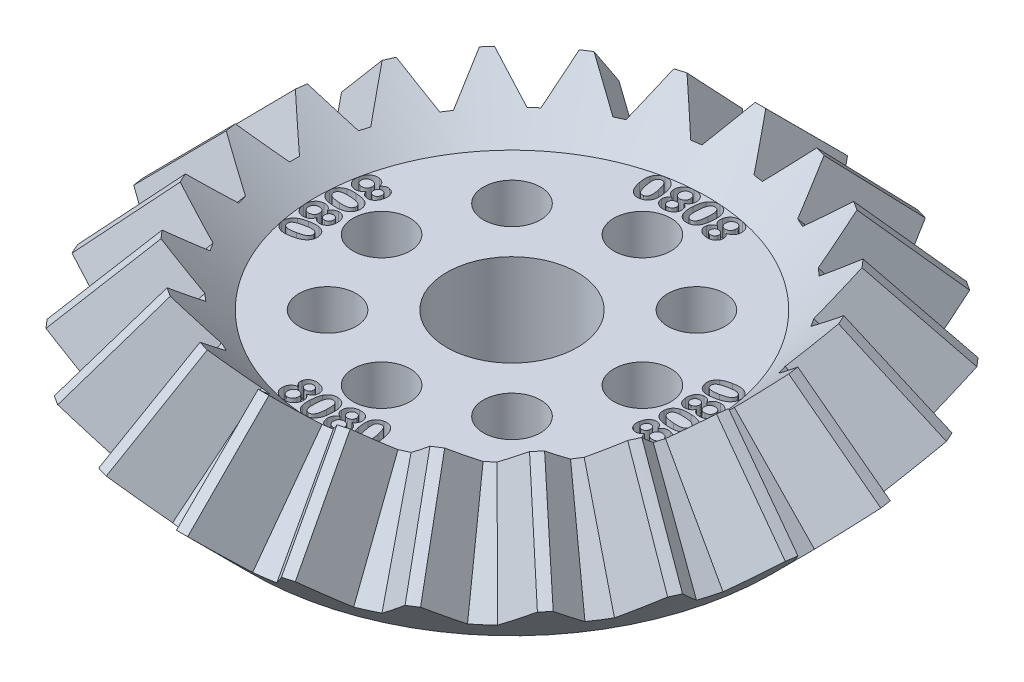
from build123d import *

# Parameters (mm, degrees)
CUT_EXTRUDE3_DEPTH        = 10
SKETCH5_3_R               = 1.75
CUT_EXTRUDE4_DEPTH        = 10
CIRPATTERN3_COUNT         = 8
CUT_EXTRUDE9_DEPTH        = 10
CUT_EXTRUDE9_DRAFT        = -5
CIRPATTERN9_COPY_1_DEPTH  = 10
CIRPATTERN9_COPY_1_DRAFT  = -5
CIRPATTERN9_COPY_2_DEPTH  = 10
CIRPATTERN9_COPY_2_DRAFT  = -5
CIRPATTERN9_COPY_3_DEPTH  = 10
CIRPATTERN9_COPY_3_DRAFT  = -5
CIRPATTERN9_COPY_4_DEPTH  = 10
CIRPATTERN9_COPY_4_DRAFT  = -5
CIRPATTERN9_COPY_5_DEPTH  = 10
CIRPATTERN9_COPY_5_DRAFT  = -5
CIRPATTERN9_COPY_6_DEPTH  = 10
CIRPATTERN9_COPY_6_DRAFT  = -5
CIRPATTERN9_COPY_7_DEPTH  = 10
CIRPATTERN9_COPY_7_DRAFT  = -5
CIRPATTERN9_COPY_8_DEPTH  = 10
CIRPATTERN9_COPY_8_DRAFT  = -5
CIRPATTERN9_COPY_9_DEPTH  = 10
CIRPATTERN9_COPY_9_DRAFT  = -5
CIRPATTERN9_COPY_10_DEPTH = 10
CIRPATTERN9_COPY_10_DRAFT = -5
CIRPATTERN9_COPY_11_DEPTH = 10
CIRPATTERN9_COPY_11_DRAFT = -5
CIRPATTERN9_COPY_12_DEPTH = 10
CIRPATTERN9_COPY_12_DRAFT = -5
CIRPATTERN9_COPY_13_DEPTH = 10
CIRPATTERN9_COPY_13_DRAFT = -5
CIRPATTERN9_COPY_14_DEPTH = 10
CIRPATTERN9_COPY_14_DRAFT = -5
CIRPATTERN9_COPY_15_DEPTH = 10
CIRPATTERN9_COPY_15_DRAFT = -5
CIRPATTERN9_COPY_16_DEPTH = 10
CIRPATTERN9_COPY_16_DRAFT = -5
CIRPATTERN9_COPY_17_DEPTH = 10
CIRPATTERN9_COPY_17_DRAFT = -5
CIRPATTERN9_COPY_18_DEPTH = 10
CIRPATTERN9_COPY_18_DRAFT = -5
CIRPATTERN9_COPY_19_DEPTH = 10
CIRPATTERN9_COPY_19_DRAFT = -5
CIRPATTERN9_COPY_20_DEPTH = 10
CIRPATTERN9_COPY_20_DRAFT = -5
CIRPATTERN9_COPY_21_DEPTH = 10
CIRPATTERN9_COPY_21_DRAFT = -5
CUT_EXTRUDE10_DEPTH       = 1
CIRPATTERN10_COUNT        = 4


with BuildPart() as part:
    # Sketch2 → Revolve4 (revolve)
    with BuildSketch(Plane.XY):
        Polygon((0, 0), (0, 6), (-12, 6), (-15.242640687, 9.242640687), (-20.242640687, 4.242640687), (-16, 0), align=None)
    revolve(axis=Axis((0, 0, 0), (0, 1, 0)))

    # Sketch5 → Cut-Extrude3 (cut)
    with BuildSketch(Plane(origin=(0, 6, 0), x_dir=(1, 0, 0), z_dir=(0, 1, 0))):
        with BuildLine():
            ThreePointArc((4, 0), (-2.828427125, 2.828427125), (0, -4))
            ThreePointArc((0, -4), (2.828427125, -2.828427125), (4, 0))
        make_face()
    extrude(amount=-CUT_EXTRUDE3_DEPTH, mode=Mode.SUBTRACT)

    # Sketch5<3> → Cut-Extrude4 (cut)
    with BuildSketch(Plane(origin=(0, 6, 0), x_dir=(1, 0, 0), z_dir=(0, 1, 0))):
        with Locations((0, -8)):
            Circle(SKETCH5_3_R)
    cut_extrude4 = extrude(amount=-CUT_EXTRUDE4_DEPTH, mode=Mode.SUBTRACT)

    # CirPattern3: Cut-Extrude4 ×8 about axis
    cirpattern3_axis = Axis((0, 0, 0), (0, 1, 0))
    for i in range(1, CIRPATTERN3_COUNT):
        add(cut_extrude4.rotate(cirpattern3_axis, i * 360 / CIRPATTERN3_COUNT), mode=Mode.SUBTRACT)


with BuildPart() as cut_extrude9_tool:
    # Sketch4 → Cut-Extrude9 (with draft: the straight prism first)
    with BuildSketch(Plane(origin=(-8, -8, 0), x_dir=(0, 0, 1), z_dir=(-0.7071067811865476, -0.7071067811865475, 0))):
        Polygon((0.655287698, 14.004205364), (3, 17.955775999), (-3, 17.955775999), (-0.655287698, 14.004205364), align=None)
    extrude(amount=-CUT_EXTRUDE9_DEPTH)
    # Cut-Extrude9: the draft: its side faces are tilted about the plane it starts from
    cut_extrude9_sides = [cut_extrude9_tool.faces().sort_by_distance(p)[0] for p in [
        (-15.764025868, 6.83509368, 1.827643849),
        (-17.161117065, 8.232184876, 0),
        (-15.764025868, 6.83509368, -1.827643849),
        (-14.366934672, 5.438002484, 0),
    ]]
    draft(cut_extrude9_sides, Plane(origin=(-8, -8, 0), x_dir=(0, 0, 1), z_dir=(-0.7071067811865476, -0.7071067811865475, 0)), CUT_EXTRUDE9_DRAFT)


with BuildPart() as part_1:
    add(part.part)

    # Cut-Extrude9: cut by cut_extrude9_tool
    add(cut_extrude9_tool.part, mode=Mode.SUBTRACT)


with BuildPart() as cirpattern9_copy_1_tool:
    # CirPattern9 copy 1 sketch → CirPattern9 copy 1 (with draft: the straight prism first)
    with BuildSketch(Plane(origin=(-7.675943789, -8, 2.253860455), x_dir=(0.28173255684142967, 0, 0.9594929736144974), z_dir=(-0.6784639881436563, -0.7071067811865475, 0.19921500142359938))):
        Polygon((0.655287698, 14.004205364), (3, 17.955775999), (-3, 17.955775999), (-0.655287698, 14.004205364), align=None)
    extrude(amount=-CIRPATTERN9_COPY_1_DEPTH)
    # CirPattern9 copy 1: the draft: its side faces are tilted about the plane it starts from
    cirpattern9_copy_1_sides = [cirpattern9_copy_1_tool.faces().sort_by_distance(p)[0] for p in [
        (-14.610565282, 6.83509368, 6.194850745),
        (-16.465971243, 8.232184876, 4.834845389),
        (-15.640378831, 6.83509368, 2.687627883),
        (-13.78497287, 5.438002484, 4.047633239),
    ]]
    draft(cirpattern9_copy_1_sides, Plane(origin=(-7.675943789, -8, 2.253860455), x_dir=(0.28173255684142967, 0, 0.9594929736144974), z_dir=(-0.6784639881436563, -0.7071067811865475, 0.19921500142359938)), CIRPATTERN9_COPY_1_DRAFT)


with BuildPart() as part_2:
    add(part_1.part)

    # CirPattern9 copy 1: cut by cirpattern9_copy_1_tool
    add(cirpattern9_copy_1_tool.part, mode=Mode.SUBTRACT)


with BuildPart() as cirpattern9_copy_2_tool:
    # CirPattern9 copy 2 sketch → CirPattern9 copy 2 (with draft: the straight prism first)
    with BuildSketch(Plane(origin=(-6.730028263, -8, 4.32512654), x_dir=(0.5406408174555976, 0, 0.8412535328311812), z_dir=(-0.5948560777620682, -0.7071067811865475, 0.3822907882090914))):
        Polygon((0.655287698, 14.004205364), (3, 17.955775999), (-3, 17.955775999), (-0.655287698, 14.004205364), align=None)
    extrude(amount=-CIRPATTERN9_COPY_2_DEPTH)
    # CirPattern9 copy 2: the draft: its side faces are tilted about the plane it starts from
    cirpattern9_copy_2_sides = [cirpattern9_copy_2_tool.faces().sort_by_distance(p)[0] for p in [
        (-12.273443589, 6.83509368, 10.060187676),
        (-14.436850358, 8.232184876, 9.278000358),
        (-14.249641318, 6.83509368, 6.985163987),
        (-12.086234549, 5.438002484, 7.767351305),
    ]]
    draft(cirpattern9_copy_2_sides, Plane(origin=(-6.730028263, -8, 4.32512654), x_dir=(0.5406408174555976, 0, 0.8412535328311812), z_dir=(-0.5948560777620682, -0.7071067811865475, 0.3822907882090914)), CIRPATTERN9_COPY_2_DRAFT)


with BuildPart() as part_3:
    add(part_2.part)

    # CirPattern9 copy 2: cut by cirpattern9_copy_2_tool
    add(cirpattern9_copy_2_tool.part, mode=Mode.SUBTRACT)


with BuildPart() as cirpattern9_copy_3_tool:
    # CirPattern9 copy 3 sketch → CirPattern9 copy 3 (with draft: the straight prism first)
    with BuildSketch(Plane(origin=(-5.238885872, -8, 6.045996595), x_dir=(0.7557495743542583, 0, 0.654860733945285), z_dir=(-0.46305646570551057, -0.7071067811865475, 0.534395648904743))):
        Polygon((0.655287698, 14.004205364), (3, 17.955775999), (-3, 17.955775999), (-0.655287698, 14.004205364), align=None)
    extrude(amount=-CIRPATTERN9_COPY_3_DEPTH)
    # CirPattern9 copy 3: the draft: its side faces are tilted about the plane it starts from
    cirpattern9_copy_3_sides = [cirpattern9_copy_3_tool.faces().sort_by_distance(p)[0] for p in [
        (-8.942000489, 6.83509368, 13.110508032),
        (-11.238141717, 8.232184876, 12.969506917),
        (-11.704482611, 6.83509368, 10.716803648),
        (-9.408341384, 5.438002484, 10.857804763),
    ]]
    draft(cirpattern9_copy_3_sides, Plane(origin=(-5.238885872, -8, 6.045996595), x_dir=(0.7557495743542583, 0, 0.654860733945285), z_dir=(-0.46305646570551057, -0.7071067811865475, 0.534395648904743)), CIRPATTERN9_COPY_3_DRAFT)


with BuildPart() as part_4:
    add(part_3.part)

    # CirPattern9 copy 3: cut by cirpattern9_copy_3_tool
    add(cirpattern9_copy_3_tool.part, mode=Mode.SUBTRACT)


with BuildPart() as cirpattern9_copy_4_tool:
    # CirPattern9 copy 4 sketch → CirPattern9 copy 4 (with draft: the straight prism first)
    with BuildSketch(Plane(origin=(-3.323320104, -8, 7.277055963), x_dir=(0.9096319953545183, 0, 0.41541501300188644), z_dir=(-0.2937427727003317, -0.7071067811865475, 0.64320695229943))):
        Polygon((0.655287698, 14.004205364), (3, 17.955775999), (-3, 17.955775999), (-0.655287698, 14.004205364), align=None)
    extrude(amount=-CIRPATTERN9_COPY_4_DEPTH)
    # CirPattern9 copy 4: the draft: its side faces are tilted about the plane it starts from
    cirpattern9_copy_4_sides = [cirpattern9_copy_4_tool.faces().sort_by_distance(p)[0] for p in [
        (-4.88612969, 6.83509368, 15.098692998),
        (-7.128985669, 8.232184876, 15.610301158),
        (-8.211096332, 6.83509368, 13.580231612),
        (-5.968240354, 5.438002484, 13.068623453),
    ]]
    draft(cirpattern9_copy_4_sides, Plane(origin=(-3.323320104, -8, 7.277055963), x_dir=(0.9096319953545183, 0, 0.41541501300188644), z_dir=(-0.2937427727003317, -0.7071067811865475, 0.64320695229943)), CIRPATTERN9_COPY_4_DRAFT)


with BuildPart() as part_5:
    add(part_4.part)

    # CirPattern9 copy 4: cut by cirpattern9_copy_4_tool
    add(cirpattern9_copy_4_tool.part, mode=Mode.SUBTRACT)


with BuildPart() as cirpattern9_copy_5_tool:
    # CirPattern9 copy 5 sketch → CirPattern9 copy 5 (with draft: the straight prism first)
    with BuildSketch(Plane(origin=(-1.138518706, -8, 7.918571535), x_dir=(0.9898214418809327, 0, 0.14231483827328534), z_dir=(-0.10063178720650688, -0.7071067811865475, 0.6999094537178537))):
        Polygon((0.655287698, 14.004205364), (3, 17.955775999), (-3, 17.955775999), (-0.655287698, 14.004205364), align=None)
    extrude(amount=-CIRPATTERN9_COPY_5_DEPTH)
    # CirPattern9 copy 5: the draft: its side faces are tilted about the plane it starts from
    cirpattern9_copy_5_sides = [cirpattern9_copy_5_tool.faces().sort_by_distance(p)[0] for p in [
        (-0.434413722, 6.83509368, 15.863671653),
        (-2.4422816, 8.232184876, 16.986441638),
        (-4.052495862, 6.83509368, 15.343469976),
        (-2.044627984, 5.438002484, 14.220699992),
    ]]
    draft(cirpattern9_copy_5_sides, Plane(origin=(-1.138518706, -8, 7.918571535), x_dir=(0.9898214418809327, 0, 0.14231483827328534), z_dir=(-0.10063178720650688, -0.7071067811865475, 0.6999094537178537)), CIRPATTERN9_COPY_5_DRAFT)


with BuildPart() as part_6:
    add(part_5.part)

    # CirPattern9 copy 5: cut by cirpattern9_copy_5_tool
    add(cirpattern9_copy_5_tool.part, mode=Mode.SUBTRACT)


with BuildPart() as cirpattern9_copy_6_tool:
    # CirPattern9 copy 6 sketch → CirPattern9 copy 6 (with draft: the straight prism first)
    with BuildSketch(Plane(origin=(1.138518706, -8, 7.918571535), x_dir=(0.9898214418809327, 0, -0.14231483827328523), z_dir=(0.1006317872065068, -0.7071067811865475, 0.6999094537178537))):
        Polygon((0.655287698, 14.004205364), (3, 17.955775999), (-3, 17.955775999), (-0.655287698, 14.004205364), align=None)
    extrude(amount=-CIRPATTERN9_COPY_6_DEPTH)
    # CirPattern9 copy 6: the draft: its side faces are tilted about the plane it starts from
    cirpattern9_copy_6_sides = [cirpattern9_copy_6_tool.faces().sort_by_distance(p)[0] for p in [
        (4.052495862, 6.83509368, 15.343469976),
        (2.4422816, 8.232184876, 16.986441638),
        (0.434413722, 6.83509368, 15.863671653),
        (2.044627984, 5.438002484, 14.220699992),
    ]]
    draft(cirpattern9_copy_6_sides, Plane(origin=(1.138518706, -8, 7.918571535), x_dir=(0.9898214418809327, 0, -0.14231483827328523), z_dir=(0.1006317872065068, -0.7071067811865475, 0.6999094537178537)), CIRPATTERN9_COPY_6_DRAFT)


with BuildPart() as part_7:
    add(part_6.part)

    # CirPattern9 copy 6: cut by cirpattern9_copy_6_tool
    add(cirpattern9_copy_6_tool.part, mode=Mode.SUBTRACT)


with BuildPart() as cirpattern9_copy_7_tool:
    # CirPattern9 copy 7 sketch → CirPattern9 copy 7 (with draft: the straight prism first)
    with BuildSketch(Plane(origin=(3.323320104, -8, 7.277055963), x_dir=(0.9096319953545184, 0, -0.4154150130018863), z_dir=(0.29374277270033167, -0.7071067811865475, 0.6432069522994301))):
        Polygon((0.655287698, 14.004205364), (3, 17.955775999), (-3, 17.955775999), (-0.655287698, 14.004205364), align=None)
    extrude(amount=-CIRPATTERN9_COPY_7_DEPTH)
    # CirPattern9 copy 7: the draft: its side faces are tilted about the plane it starts from
    cirpattern9_copy_7_sides = [cirpattern9_copy_7_tool.faces().sort_by_distance(p)[0] for p in [
        (8.211096332, 6.83509368, 13.580231612),
        (7.128985669, 8.232184876, 15.610301158),
        (4.88612969, 6.83509368, 15.098692998),
        (5.968240354, 5.438002484, 13.068623453),
    ]]
    draft(cirpattern9_copy_7_sides, Plane(origin=(3.323320104, -8, 7.277055963), x_dir=(0.9096319953545184, 0, -0.4154150130018863), z_dir=(0.29374277270033167, -0.7071067811865475, 0.6432069522994301)), CIRPATTERN9_COPY_7_DRAFT)


with BuildPart() as part_8:
    add(part_7.part)

    # CirPattern9 copy 7: cut by cirpattern9_copy_7_tool
    add(cirpattern9_copy_7_tool.part, mode=Mode.SUBTRACT)


with BuildPart() as cirpattern9_copy_8_tool:
    # CirPattern9 copy 8 sketch → CirPattern9 copy 8 (with draft: the straight prism first)
    with BuildSketch(Plane(origin=(5.238885872, -8, 6.045996595), x_dir=(0.7557495743542583, 0, -0.654860733945285), z_dir=(0.46305646570551057, -0.7071067811865475, 0.534395648904743))):
        Polygon((0.655287698, 14.004205364), (3, 17.955775999), (-3, 17.955775999), (-0.655287698, 14.004205364), align=None)
    extrude(amount=-CIRPATTERN9_COPY_8_DEPTH)
    # CirPattern9 copy 8: the draft: its side faces are tilted about the plane it starts from
    cirpattern9_copy_8_sides = [cirpattern9_copy_8_tool.faces().sort_by_distance(p)[0] for p in [
        (11.704482611, 6.83509368, 10.716803648),
        (11.238141717, 8.232184876, 12.969506917),
        (8.942000489, 6.83509368, 13.110508032),
        (9.408341384, 5.438002484, 10.857804763),
    ]]
    draft(cirpattern9_copy_8_sides, Plane(origin=(5.238885872, -8, 6.045996595), x_dir=(0.7557495743542583, 0, -0.654860733945285), z_dir=(0.46305646570551057, -0.7071067811865475, 0.534395648904743)), CIRPATTERN9_COPY_8_DRAFT)


with BuildPart() as part_9:
    add(part_8.part)

    # CirPattern9 copy 8: cut by cirpattern9_copy_8_tool
    add(cirpattern9_copy_8_tool.part, mode=Mode.SUBTRACT)


with BuildPart() as cirpattern9_copy_9_tool:
    # CirPattern9 copy 9 sketch → CirPattern9 copy 9 (with draft: the straight prism first)
    with BuildSketch(Plane(origin=(6.730028263, -8, 4.32512654), x_dir=(0.5406408174555974, 0, -0.8412535328311813), z_dir=(0.5948560777620683, -0.7071067811865475, 0.38229078820909135))):
        Polygon((0.655287698, 14.004205364), (3, 17.955775999), (-3, 17.955775999), (-0.655287698, 14.004205364), align=None)
    extrude(amount=-CIRPATTERN9_COPY_9_DEPTH)
    # CirPattern9 copy 9: the draft: its side faces are tilted about the plane it starts from
    cirpattern9_copy_9_sides = [cirpattern9_copy_9_tool.faces().sort_by_distance(p)[0] for p in [
        (14.249641318, 6.83509368, 6.985163987),
        (14.436850358, 8.232184876, 9.278000358),
        (12.273443589, 6.83509368, 10.060187676),
        (12.086234549, 5.438002484, 7.767351305),
    ]]
    draft(cirpattern9_copy_9_sides, Plane(origin=(6.730028263, -8, 4.32512654), x_dir=(0.5406408174555974, 0, -0.8412535328311813), z_dir=(0.5948560777620683, -0.7071067811865475, 0.38229078820909135)), CIRPATTERN9_COPY_9_DRAFT)


with BuildPart() as part_10:
    add(part_9.part)

    # CirPattern9 copy 9: cut by cirpattern9_copy_9_tool
    add(cirpattern9_copy_9_tool.part, mode=Mode.SUBTRACT)


with BuildPart() as cirpattern9_copy_10_tool:
    # CirPattern9 copy 10 sketch → CirPattern9 copy 10 (with draft: the straight prism first)
    with BuildSketch(Plane(origin=(7.675943789, -8, 2.253860455), x_dir=(0.28173255684143006, 0, -0.9594929736144973), z_dir=(0.6784639881436562, -0.7071067811865475, 0.19921500142359966))):
        Polygon((0.655287698, 14.004205364), (3, 17.955775999), (-3, 17.955775999), (-0.655287698, 14.004205364), align=None)
    extrude(amount=-CIRPATTERN9_COPY_10_DEPTH)
    # CirPattern9 copy 10: the draft: its side faces are tilted about the plane it starts from
    cirpattern9_copy_10_sides = [cirpattern9_copy_10_tool.faces().sort_by_distance(p)[0] for p in [
        (15.640378831, 6.83509368, 2.687627883),
        (16.465971243, 8.232184876, 4.834845389),
        (14.610565282, 6.83509368, 6.194850745),
        (13.78497287, 5.438002484, 4.047633239),
    ]]
    draft(cirpattern9_copy_10_sides, Plane(origin=(7.675943789, -8, 2.253860455), x_dir=(0.28173255684143006, 0, -0.9594929736144973), z_dir=(0.6784639881436562, -0.7071067811865475, 0.19921500142359966)), CIRPATTERN9_COPY_10_DRAFT)


with BuildPart() as part_11:
    add(part_10.part)

    # CirPattern9 copy 10: cut by cirpattern9_copy_10_tool
    add(cirpattern9_copy_10_tool.part, mode=Mode.SUBTRACT)


with BuildPart() as cirpattern9_copy_11_tool:
    # CirPattern9 copy 11 sketch → CirPattern9 copy 11 (with draft: the straight prism first)
    with BuildSketch(Plane(origin=(8, -8, 0), x_dir=(0, 0, -1), z_dir=(0.7071067811865476, -0.7071067811865475, 0))):
        Polygon((0.655287698, 14.004205364), (3, 17.955775999), (-3, 17.955775999), (-0.655287698, 14.004205364), align=None)
    extrude(amount=-CIRPATTERN9_COPY_11_DEPTH)
    # CirPattern9 copy 11: the draft: its side faces are tilted about the plane it starts from
    cirpattern9_copy_11_sides = [cirpattern9_copy_11_tool.faces().sort_by_distance(p)[0] for p in [
        (15.764025868, 6.83509368, -1.827643849),
        (17.161117065, 8.232184876, 0),
        (15.764025868, 6.83509368, 1.827643849),
        (14.366934672, 5.438002484, 0),
    ]]
    draft(cirpattern9_copy_11_sides, Plane(origin=(8, -8, 0), x_dir=(0, 0, -1), z_dir=(0.7071067811865476, -0.7071067811865475, 0)), CIRPATTERN9_COPY_11_DRAFT)


with BuildPart() as part_12:
    add(part_11.part)

    # CirPattern9 copy 11: cut by cirpattern9_copy_11_tool
    add(cirpattern9_copy_11_tool.part, mode=Mode.SUBTRACT)


with BuildPart() as cirpattern9_copy_12_tool:
    # CirPattern9 copy 12 sketch → CirPattern9 copy 12 (with draft: the straight prism first)
    with BuildSketch(Plane(origin=(7.675943789, -8, -2.253860455), x_dir=(-0.28173255684142984, 0, -0.9594929736144974), z_dir=(0.6784639881436563, -0.7071067811865475, -0.1992150014235995))):
        Polygon((0.655287698, 14.004205364), (3, 17.955775999), (-3, 17.955775999), (-0.655287698, 14.004205364), align=None)
    extrude(amount=-CIRPATTERN9_COPY_12_DEPTH)
    # CirPattern9 copy 12: the draft: its side faces are tilted about the plane it starts from
    cirpattern9_copy_12_sides = [cirpattern9_copy_12_tool.faces().sort_by_distance(p)[0] for p in [
        (14.610565282, 6.83509368, -6.194850745),
        (16.465971243, 8.232184876, -4.834845389),
        (15.640378831, 6.83509368, -2.687627883),
        (13.78497287, 5.438002484, -4.047633239),
    ]]
    draft(cirpattern9_copy_12_sides, Plane(origin=(7.675943789, -8, -2.253860455), x_dir=(-0.28173255684142984, 0, -0.9594929736144974), z_dir=(0.6784639881436563, -0.7071067811865475, -0.1992150014235995)), CIRPATTERN9_COPY_12_DRAFT)


with BuildPart() as part_13:
    add(part_12.part)

    # CirPattern9 copy 12: cut by cirpattern9_copy_12_tool
    add(cirpattern9_copy_12_tool.part, mode=Mode.SUBTRACT)


with BuildPart() as cirpattern9_copy_13_tool:
    # CirPattern9 copy 13 sketch → CirPattern9 copy 13 (with draft: the straight prism first)
    with BuildSketch(Plane(origin=(6.730028263, -8, -4.32512654), x_dir=(-0.5406408174555976, 0, -0.8412535328311812), z_dir=(0.5948560777620682, -0.7071067811865475, -0.3822907882090914))):
        Polygon((0.655287698, 14.004205364), (3, 17.955775999), (-3, 17.955775999), (-0.655287698, 14.004205364), align=None)
    extrude(amount=-CIRPATTERN9_COPY_13_DEPTH)
    # CirPattern9 copy 13: the draft: its side faces are tilted about the plane it starts from
    cirpattern9_copy_13_sides = [cirpattern9_copy_13_tool.faces().sort_by_distance(p)[0] for p in [
        (12.273443589, 6.83509368, -10.060187676),
        (14.436850358, 8.232184876, -9.278000358),
        (14.249641318, 6.83509368, -6.985163987),
        (12.086234549, 5.438002484, -7.767351305),
    ]]
    draft(cirpattern9_copy_13_sides, Plane(origin=(6.730028263, -8, -4.32512654), x_dir=(-0.5406408174555976, 0, -0.8412535328311812), z_dir=(0.5948560777620682, -0.7071067811865475, -0.3822907882090914)), CIRPATTERN9_COPY_13_DRAFT)


with BuildPart() as part_14:
    add(part_13.part)

    # CirPattern9 copy 13: cut by cirpattern9_copy_13_tool
    add(cirpattern9_copy_13_tool.part, mode=Mode.SUBTRACT)


with BuildPart() as cirpattern9_copy_14_tool:
    # CirPattern9 copy 14 sketch → CirPattern9 copy 14 (with draft: the straight prism first)
    with BuildSketch(Plane(origin=(5.238885872, -8, -6.045996595), x_dir=(-0.7557495743542582, 0, -0.6548607339452852), z_dir=(0.46305646570551073, -0.7071067811865475, -0.5343956489047429))):
        Polygon((0.655287698, 14.004205364), (3, 17.955775999), (-3, 17.955775999), (-0.655287698, 14.004205364), align=None)
    extrude(amount=-CIRPATTERN9_COPY_14_DEPTH)
    # CirPattern9 copy 14: the draft: its side faces are tilted about the plane it starts from
    cirpattern9_copy_14_sides = [cirpattern9_copy_14_tool.faces().sort_by_distance(p)[0] for p in [
        (8.942000489, 6.83509368, -13.110508032),
        (11.238141717, 8.232184876, -12.969506917),
        (11.704482611, 6.83509368, -10.716803648),
        (9.408341384, 5.438002484, -10.857804763),
    ]]
    draft(cirpattern9_copy_14_sides, Plane(origin=(5.238885872, -8, -6.045996595), x_dir=(-0.7557495743542582, 0, -0.6548607339452852), z_dir=(0.46305646570551073, -0.7071067811865475, -0.5343956489047429)), CIRPATTERN9_COPY_14_DRAFT)


with BuildPart() as part_15:
    add(part_14.part)

    # CirPattern9 copy 14: cut by cirpattern9_copy_14_tool
    add(cirpattern9_copy_14_tool.part, mode=Mode.SUBTRACT)


with BuildPart() as cirpattern9_copy_15_tool:
    # CirPattern9 copy 15 sketch → CirPattern9 copy 15 (with draft: the straight prism first)
    with BuildSketch(Plane(origin=(3.323320104, -8, -7.277055963), x_dir=(-0.9096319953545184, 0, -0.4154150130018864), z_dir=(0.29374277270033167, -0.7071067811865475, -0.6432069522994301))):
        Polygon((0.655287698, 14.004205364), (3, 17.955775999), (-3, 17.955775999), (-0.655287698, 14.004205364), align=None)
    extrude(amount=-CIRPATTERN9_COPY_15_DEPTH)
    # CirPattern9 copy 15: the draft: its side faces are tilted about the plane it starts from
    cirpattern9_copy_15_sides = [cirpattern9_copy_15_tool.faces().sort_by_distance(p)[0] for p in [
        (4.88612969, 6.83509368, -15.098692998),
        (7.128985669, 8.232184876, -15.610301158),
        (8.211096332, 6.83509368, -13.580231612),
        (5.968240354, 5.438002484, -13.068623453),
    ]]
    draft(cirpattern9_copy_15_sides, Plane(origin=(3.323320104, -8, -7.277055963), x_dir=(-0.9096319953545184, 0, -0.4154150130018864), z_dir=(0.29374277270033167, -0.7071067811865475, -0.6432069522994301)), CIRPATTERN9_COPY_15_DRAFT)


with BuildPart() as part_16:
    add(part_15.part)

    # CirPattern9 copy 15: cut by cirpattern9_copy_15_tool
    add(cirpattern9_copy_15_tool.part, mode=Mode.SUBTRACT)


with BuildPart() as cirpattern9_copy_16_tool:
    # CirPattern9 copy 16 sketch → CirPattern9 copy 16 (with draft: the straight prism first)
    with BuildSketch(Plane(origin=(1.138518706, -8, -7.918571535), x_dir=(-0.9898214418809327, 0, -0.14231483827328523), z_dir=(0.1006317872065068, -0.7071067811865475, -0.6999094537178537))):
        Polygon((0.655287698, 14.004205364), (3, 17.955775999), (-3, 17.955775999), (-0.655287698, 14.004205364), align=None)
    extrude(amount=-CIRPATTERN9_COPY_16_DEPTH)
    # CirPattern9 copy 16: the draft: its side faces are tilted about the plane it starts from
    cirpattern9_copy_16_sides = [cirpattern9_copy_16_tool.faces().sort_by_distance(p)[0] for p in [
        (0.434413722, 6.83509368, -15.863671653),
        (2.4422816, 8.232184876, -16.986441638),
        (4.052495862, 6.83509368, -15.343469976),
        (2.044627984, 5.438002484, -14.220699992),
    ]]
    draft(cirpattern9_copy_16_sides, Plane(origin=(1.138518706, -8, -7.918571535), x_dir=(-0.9898214418809327, 0, -0.14231483827328523), z_dir=(0.1006317872065068, -0.7071067811865475, -0.6999094537178537)), CIRPATTERN9_COPY_16_DRAFT)


with BuildPart() as part_17:
    add(part_16.part)

    # CirPattern9 copy 16: cut by cirpattern9_copy_16_tool
    add(cirpattern9_copy_16_tool.part, mode=Mode.SUBTRACT)


with BuildPart() as cirpattern9_copy_17_tool:
    # CirPattern9 copy 17 sketch → CirPattern9 copy 17 (with draft: the straight prism first)
    with BuildSketch(Plane(origin=(-1.138518706, -8, -7.918571535), x_dir=(-0.9898214418809328, 0, 0.14231483827328487), z_dir=(-0.10063178720650655, -0.7071067811865475, -0.6999094537178537))):
        Polygon((0.655287698, 14.004205364), (3, 17.955775999), (-3, 17.955775999), (-0.655287698, 14.004205364), align=None)
    extrude(amount=-CIRPATTERN9_COPY_17_DEPTH)
    # CirPattern9 copy 17: the draft: its side faces are tilted about the plane it starts from
    cirpattern9_copy_17_sides = [cirpattern9_copy_17_tool.faces().sort_by_distance(p)[0] for p in [
        (-4.052495862, 6.83509368, -15.343469976),
        (-2.4422816, 8.232184876, -16.986441638),
        (-0.434413722, 6.83509368, -15.863671653),
        (-2.044627984, 5.438002484, -14.220699992),
    ]]
    draft(cirpattern9_copy_17_sides, Plane(origin=(-1.138518706, -8, -7.918571535), x_dir=(-0.9898214418809328, 0, 0.14231483827328487), z_dir=(-0.10063178720650655, -0.7071067811865475, -0.6999094537178537)), CIRPATTERN9_COPY_17_DRAFT)


with BuildPart() as part_18:
    add(part_17.part)

    # CirPattern9 copy 17: cut by cirpattern9_copy_17_tool
    add(cirpattern9_copy_17_tool.part, mode=Mode.SUBTRACT)


with BuildPart() as cirpattern9_copy_18_tool:
    # CirPattern9 copy 18 sketch → CirPattern9 copy 18 (with draft: the straight prism first)
    with BuildSketch(Plane(origin=(-3.323320104, -8, -7.277055963), x_dir=(-0.9096319953545182, 0, 0.4154150130018868), z_dir=(-0.293742772700332, -0.7071067811865475, -0.6432069522994299))):
        Polygon((0.655287698, 14.004205364), (3, 17.955775999), (-3, 17.955775999), (-0.655287698, 14.004205364), align=None)
    extrude(amount=-CIRPATTERN9_COPY_18_DEPTH)
    # CirPattern9 copy 18: the draft: its side faces are tilted about the plane it starts from
    cirpattern9_copy_18_sides = [cirpattern9_copy_18_tool.faces().sort_by_distance(p)[0] for p in [
        (-8.211096332, 6.83509368, -13.580231612),
        (-7.128985669, 8.232184876, -15.610301158),
        (-4.88612969, 6.83509368, -15.098692998),
        (-5.968240354, 5.438002484, -13.068623453),
    ]]
    draft(cirpattern9_copy_18_sides, Plane(origin=(-3.323320104, -8, -7.277055963), x_dir=(-0.9096319953545182, 0, 0.4154150130018868), z_dir=(-0.293742772700332, -0.7071067811865475, -0.6432069522994299)), CIRPATTERN9_COPY_18_DRAFT)


with BuildPart() as part_19:
    add(part_18.part)

    # CirPattern9 copy 18: cut by cirpattern9_copy_18_tool
    add(cirpattern9_copy_18_tool.part, mode=Mode.SUBTRACT)


with BuildPart() as cirpattern9_copy_19_tool:
    # CirPattern9 copy 19 sketch → CirPattern9 copy 19 (with draft: the straight prism first)
    with BuildSketch(Plane(origin=(-5.238885872, -8, -6.045996595), x_dir=(-0.7557495743542587, 0, 0.6548607339452845), z_dir=(-0.4630564657055103, -0.7071067811865475, -0.5343956489047432))):
        Polygon((0.655287698, 14.004205364), (3, 17.955775999), (-3, 17.955775999), (-0.655287698, 14.004205364), align=None)
    extrude(amount=-CIRPATTERN9_COPY_19_DEPTH)
    # CirPattern9 copy 19: the draft: its side faces are tilted about the plane it starts from
    cirpattern9_copy_19_sides = [cirpattern9_copy_19_tool.faces().sort_by_distance(p)[0] for p in [
        (-11.704482611, 6.83509368, -10.716803648),
        (-11.238141717, 8.232184876, -12.969506917),
        (-8.942000489, 6.83509368, -13.110508032),
        (-9.408341384, 5.438002484, -10.857804763),
    ]]
    draft(cirpattern9_copy_19_sides, Plane(origin=(-5.238885872, -8, -6.045996595), x_dir=(-0.7557495743542587, 0, 0.6548607339452845), z_dir=(-0.4630564657055103, -0.7071067811865475, -0.5343956489047432)), CIRPATTERN9_COPY_19_DRAFT)


with BuildPart() as part_20:
    add(part_19.part)

    # CirPattern9 copy 19: cut by cirpattern9_copy_19_tool
    add(cirpattern9_copy_19_tool.part, mode=Mode.SUBTRACT)


with BuildPart() as cirpattern9_copy_20_tool:
    # CirPattern9 copy 20 sketch → CirPattern9 copy 20 (with draft: the straight prism first)
    with BuildSketch(Plane(origin=(-6.730028263, -8, -4.32512654), x_dir=(-0.5406408174555982, 0, 0.8412535328311808), z_dir=(-0.5948560777620678, -0.7071067811865475, -0.3822907882090919))):
        Polygon((0.655287698, 14.004205364), (3, 17.955775999), (-3, 17.955775999), (-0.655287698, 14.004205364), align=None)
    extrude(amount=-CIRPATTERN9_COPY_20_DEPTH)
    # CirPattern9 copy 20: the draft: its side faces are tilted about the plane it starts from
    cirpattern9_copy_20_sides = [cirpattern9_copy_20_tool.faces().sort_by_distance(p)[0] for p in [
        (-14.249641318, 6.83509368, -6.985163987),
        (-14.436850358, 8.232184876, -9.278000358),
        (-12.273443589, 6.83509368, -10.060187676),
        (-12.086234549, 5.438002484, -7.767351305),
    ]]
    draft(cirpattern9_copy_20_sides, Plane(origin=(-6.730028263, -8, -4.32512654), x_dir=(-0.5406408174555982, 0, 0.8412535328311808), z_dir=(-0.5948560777620678, -0.7071067811865475, -0.3822907882090919)), CIRPATTERN9_COPY_20_DRAFT)


with BuildPart() as part_21:
    add(part_20.part)

    # CirPattern9 copy 20: cut by cirpattern9_copy_20_tool
    add(cirpattern9_copy_20_tool.part, mode=Mode.SUBTRACT)


with BuildPart() as cirpattern9_copy_21_tool:
    # CirPattern9 copy 21 sketch → CirPattern9 copy 21 (with draft: the straight prism first)
    with BuildSketch(Plane(origin=(-7.675943789, -8, -2.253860455), x_dir=(-0.2817325568414298, 0, 0.9594929736144974), z_dir=(-0.6784639881436563, -0.7071067811865475, -0.19921500142359946))):
        Polygon((0.655287698, 14.004205364), (3, 17.955775999), (-3, 17.955775999), (-0.655287698, 14.004205364), align=None)
    extrude(amount=-CIRPATTERN9_COPY_21_DEPTH)
    # CirPattern9 copy 21: the draft: its side faces are tilted about the plane it starts from
    cirpattern9_copy_21_sides = [cirpattern9_copy_21_tool.faces().sort_by_distance(p)[0] for p in [
        (-15.640378831, 6.83509368, -2.687627883),
        (-16.465971243, 8.232184876, -4.834845389),
        (-14.610565282, 6.83509368, -6.194850745),
        (-13.78497287, 5.438002484, -4.047633239),
    ]]
    draft(cirpattern9_copy_21_sides, Plane(origin=(-7.675943789, -8, -2.253860455), x_dir=(-0.2817325568414298, 0, 0.9594929736144974), z_dir=(-0.6784639881436563, -0.7071067811865475, -0.19921500142359946)), CIRPATTERN9_COPY_21_DRAFT)


with BuildPart() as part_22:
    add(part_21.part)

    # CirPattern9 copy 21: cut by cirpattern9_copy_21_tool
    add(cirpattern9_copy_21_tool.part, mode=Mode.SUBTRACT)

    # Sketch6 → Cut-Extrude10 (cut)
    # profile 1 of 4: a face of its own
    with BuildSketch(Plane(origin=(0, 6, 0), x_dir=(1, 0, 0), z_dir=(0, 1, 0))):
        with BuildLine():
            add(Edge.make_bspline(
                [(2.856464237, -10.674186552), (2.86301114, -10.70746857), (2.875604707, -10.771489588), (2.889046277, -10.864866803), (2.898886419, -10.951467691), (2.903271988, -11.032326107), (2.902972141, -11.108731392), (2.895780004, -11.182167147), (2.882868034, -11.253378388), (2.869129086, -11.299163516), (2.862323612, -11.321842802)],
                knots=[0, 0, 0, 0, 1.242240845, 2.389564305, 3.454538346, 4.433669945, 5.35421174, 6.250210014, 7.133255941, 8, 8, 8, 8], degree=3))
            add(Edge.make_bspline(
                [(2.862323612, -11.321842802), (2.852227982, -11.350140095), (2.832451329, -11.405572567), (2.791158422, -11.482269275), (2.742074851, -11.5515719), (2.693825223, -11.602241125), (2.652240235, -11.639110293), (2.618865547, -11.663455668), (2.58452233, -11.686017633), (2.548346458, -11.705484239), (2.510782258, -11.722750724), (2.471606508, -11.737529259), (2.430980003, -11.750284603), (2.40300418, -11.75630473), (2.388886112, -11.759342802)],
                knots=[0, 0, 0, 0, 1.594196746, 3.122922871, 4.610547235, 6.093258345, 6.82857878, 7.560442241, 8.28570525, 9.010010991, 9.740500182, 10.480491013, 11.233176019, 12, 12, 12, 12], degree=3))
            add(Edge.make_bspline(
                [(2.388886112, -11.759342802), (2.372518462, -11.762344441), (2.340199736, -11.768271325), (2.291578196, -11.772426929), (2.243638006, -11.772932666), (2.196244232, -11.769259888), (2.149195606, -11.762323253), (2.102660441, -11.751388374), (2.05691574, -11.736351802), (2.011838411, -11.718153686), (1.968449662, -11.695763056), (1.926252796, -11.670723708), (1.885949503, -11.642196874), (1.847835702, -11.610023244), (1.811269161, -11.575205677), (1.776795523, -11.536996136), (1.743896015, -11.495729746), (1.723973038, -11.466127287), (1.713886112, -11.451139677)],
                knots=[0, 0, 0, 0, 1.009576416, 1.993458057, 2.957716521, 3.916680837, 4.875710288, 5.841910214, 6.814168283, 7.796047999, 8.789281496, 9.774685683, 10.772468341, 11.782384999, 12.799758202, 13.834874351, 14.903805263, 16, 16, 16, 16], degree=3))
            add(Edge.make_bspline(
                [(1.713886112, -11.451139677), (1.703876519, -11.434738932), (1.683517323, -11.401380335), (1.657058611, -11.347882221), (1.631297068, -11.291710561), (1.608548415, -11.23181124), (1.587375533, -11.168887907), (1.568431728, -11.102728286), (1.550683419, -11.03374743), (1.540785619, -10.986468446), (1.535761112, -10.962467802)],
                knots=[0, 0, 0, 0, 0.881426141, 1.792792955, 2.736956775, 3.716924484, 4.731750058, 5.783302333, 6.874718359, 8, 8, 8, 8], degree=3))
            add(Edge.make_bspline(
                [(1.535761112, -10.962467802), (1.529833855, -10.931512993), (1.518306003, -10.87130936), (1.504734655, -10.782688321), (1.494016287, -10.698439472), (1.486813052, -10.618317903), (1.483577055, -10.542574345), (1.484294983, -10.471514129), (1.488589948, -10.405045291), (1.495102735, -10.362693712), (1.498261112, -10.342155302)],
                knots=[0, 0, 0, 0, 1.210677909, 2.354632883, 3.443498732, 4.47287823, 5.444113867, 6.354554314, 7.20204066, 8, 8, 8, 8], degree=3))
            add(Edge.make_bspline(
                [(1.498261112, -10.342155302), (1.501668463, -10.32530158), (1.508351972, -10.292243056), (1.52231845, -10.244284278), (1.538510915, -10.198649815), (1.557746695, -10.155435906), (1.579739606, -10.114818001), (1.603892994, -10.076161547), (1.631404628, -10.04024486), (1.661417142, -10.006654332), (1.694094634, -9.975586836), (1.729063356, -9.947195226), (1.766523401, -9.921528423), (1.806444234, -9.898938237), (1.848762772, -9.879005517), (1.893350548, -9.861717406), (1.940461053, -9.84773395), (1.97282539, -9.840409629), (1.989276737, -9.836686552)],
                knots=[0, 0, 0, 0, 1.095393145, 2.14861028, 3.180159673, 4.179429104, 5.159600127, 6.121904536, 7.081198825, 8.039092342, 8.989951051, 9.951575424, 10.906769378, 11.880455666, 12.871560315, 13.885571198, 14.925199563, 16, 16, 16, 16], degree=3))
            add(Edge.make_bspline(
                [(1.989276737, -9.836686552), (2.011093793, -9.83273441), (2.053985867, -9.824964546), (2.118132204, -9.820976658), (2.180250222, -9.822335384), (2.240317655, -9.829800472), (2.298256191, -9.842923971), (2.353741241, -9.862460989), (2.407116435, -9.88687027), (2.457753618, -9.917860863), (2.5062284, -9.953848315), (2.552648516, -9.995258211), (2.596935615, -10.042107862), (2.623684675, -10.076806663), (2.637323612, -10.094499052)],
                knots=[0, 0, 0, 0, 1.07627022, 2.115934445, 3.115636893, 4.090826647, 5.051341732, 5.995514834, 6.94355721, 7.897069916, 8.873694526, 9.87277647, 10.915361214, 12, 12, 12, 12], degree=3))
            add(Edge.make_bspline(
                [(2.637323612, -10.094499052), (2.649082945, -10.111366213), (2.673319802, -10.146130684), (2.70499791, -10.203874704), (2.735546216, -10.267170623), (2.763965726, -10.336708286), (2.789904296, -10.412491239), (2.8146804, -10.494083888), (2.836670476, -10.58205895), (2.849741641, -10.642897063), (2.856464237, -10.674186552)],
                knots=[0, 0, 0, 0, 0.790088108, 1.628430171, 2.528594234, 3.491778536, 4.514595847, 5.607453769, 6.769495871, 8, 8, 8, 8], degree=3))
        make_face()
        with BuildLine():
            add(Edge.make_bspline(
                [(2.501386112, -10.719108427), (2.493741471, -10.68258246), (2.479180136, -10.613008641), (2.45375991, -10.514732641), (2.42708162, -10.427552327), (2.398839506, -10.351080786), (2.367922481, -10.285248563), (2.334760766, -10.228799344), (2.296936295, -10.183058506), (2.262536851, -10.152114927), (2.233486653, -10.132711844), (2.210464484, -10.121834913), (2.186525995, -10.11321938), (2.161461889, -10.106755105), (2.135189467, -10.103789658), (2.107871281, -10.103563114), (2.079342841, -10.105331131), (2.06008501, -10.108758135), (2.050214237, -10.110514677)],
                knots=[0, 0, 0, 0, 2.110143075, 4.01935186, 5.738222495, 7.264530551, 8.624887666, 9.847318779, 10.956058751, 11.96810595, 12.452141123, 12.926387654, 13.40388151, 13.889649879, 14.386509397, 14.894644834, 15.433440349, 16, 16, 16, 16], degree=3))
            add(Edge.make_bspline(
                [(2.050214237, -10.110514677), (2.036285663, -10.11374279), (2.009378681, -10.119978805), (1.972099497, -10.135937865), (1.939318432, -10.156407597), (1.910664997, -10.181330367), (1.886561885, -10.211102015), (1.867072637, -10.245487661), (1.851600554, -10.284210758), (1.841540419, -10.327714117), (1.834463021, -10.375791078), (1.831319358, -10.428954429), (1.830884121, -10.487376078), (1.834303348, -10.55097714), (1.840588964, -10.619771262), (1.850162139, -10.693742965), (1.862489797, -10.772999961), (1.873196111, -10.827346542), (1.878729862, -10.855436552)],
                knots=[0, 0, 0, 0, 0.802607413, 1.550463388, 2.267478245, 2.967856516, 3.675580349, 4.410168812, 5.182317508, 6.011494677, 6.914285185, 7.912074212, 9.002878865, 10.197584679, 11.491336072, 12.886053727, 14.390500749, 16, 16, 16, 16], degree=3))
            add(Edge.make_bspline(
                [(1.878729862, -10.855436552), (1.886661295, -10.892998096), (1.901757356, -10.964489763), (1.927539303, -11.065657266), (1.954547558, -11.155463407), (1.983214606, -11.234247141), (2.014432193, -11.302304928), (2.048514121, -11.360094659), (2.085886679, -11.408008323), (2.120419147, -11.440163421), (2.149842545, -11.460104066), (2.17265578, -11.471896344), (2.196529877, -11.48091573), (2.221332928, -11.487026983), (2.247065961, -11.491300262), (2.27392691, -11.491612324), (2.301838353, -11.490456215), (2.320424848, -11.486924701), (2.329901737, -11.485124052)],
                knots=[0, 0, 0, 0, 2.133037786, 4.059855108, 5.799337743, 7.342271595, 8.714766994, 9.954369444, 11.061747666, 12.08089731, 12.560505073, 13.032964781, 13.504648236, 13.974942341, 14.450769508, 14.950214464, 15.464734931, 16, 16, 16, 16], degree=3))
            add(Edge.make_bspline(
                [(2.329901737, -11.485124052), (2.339721768, -11.482837197), (2.358814218, -11.478391013), (2.38591969, -11.468755115), (2.411277601, -11.457777711), (2.433736242, -11.443264714), (2.455008625, -11.427880376), (2.473179569, -11.409150115), (2.489777607, -11.388912594), (2.508881389, -11.358275337), (2.527923473, -11.314429113), (2.543788357, -11.255345493), (2.552432559, -11.188664373), (2.55375336, -11.128330338), (2.551448386, -11.075986869), (2.548867891, -11.032981773), (2.54431369, -10.987301628), (2.539126452, -10.938785323), (2.531387387, -10.887808594), (2.522897561, -10.83399013), (2.51263933, -10.777512398), (2.50519819, -10.738893036), (2.501386112, -10.719108427)],
                knots=[0, 0, 0, 0, 0.690075242, 1.341668663, 1.968368604, 2.577233658, 3.169474207, 3.762318913, 4.358508892, 4.959814194, 6.229483668, 7.616447763, 9.137695519, 10.824022603, 11.743397326, 12.72649882, 13.774652417, 14.887665546, 16.068312166, 17.305903601, 18.619820697, 20, 20, 20, 20], degree=3))
        make_face(mode=Mode.SUBTRACT)
    # profile 2 of 4: a face of its own
    with BuildSketch(Plane(origin=(0, 6, 0), x_dir=(1, 0, 0), z_dir=(0, 1, 0))):
        with BuildLine():
            add(Edge.make_bspline(
                [(0.091015625, -10.5375), (0.090562136, -10.515995585), (0.089656226, -10.473037365), (0.098779814, -10.408955566), (0.117824615, -10.346521753), (0.144389199, -10.285616397), (0.18051955, -10.228072083), (0.225453106, -10.17509243), (0.279745939, -10.128272988), (0.341527469, -10.086289189), (0.411058414, -10.051242218), (0.487420864, -10.024271245), (0.570200558, -10.0056964), (0.627773305, -10.000389285), (0.657421875, -9.99765625)],
                knots=[0, 0, 0, 0, 0.885377428, 1.768671152, 2.653186392, 3.568480428, 4.498998694, 5.443018017, 6.420261347, 7.444178353, 8.514441937, 9.619293894, 10.773994056, 12, 12, 12, 12], degree=3))
            add(Edge.make_bspline(
                [(0.657421875, -9.99765625), (0.682417276, -9.996481536), (0.731117542, -9.994192759), (0.802069996, -9.997383133), (0.868770722, -10.00580227), (0.930926731, -10.020008798), (0.988906351, -10.038414183), (1.041919663, -10.062257448), (1.090776363, -10.089374996), (1.13445324, -10.121269913), (1.173844942, -10.156079256), (1.208175656, -10.1940219), (1.238000816, -10.234542219), (1.262016963, -10.278070511), (1.281594404, -10.323660296), (1.297002697, -10.370919428), (1.307175895, -10.42008646), (1.310455569, -10.453475682), (1.312109375, -10.4703125)],
                knots=[0, 0, 0, 0, 1.323619717, 2.578899647, 3.753217694, 4.876536483, 5.948622175, 6.966573872, 7.947736925, 8.90014609, 9.822571302, 10.725014941, 11.602950856, 12.479019021, 13.349405345, 14.225392214, 15.105137946, 16, 16, 16, 16], degree=3))
            add(Edge.make_bspline(
                [(1.312109375, -10.4703125), (1.312655067, -10.491678673), (1.31372408, -10.533535113), (1.306009466, -10.595266016), (1.288707399, -10.65362361), (1.26407168, -10.709104971), (1.231207918, -10.761248568), (1.188728291, -10.808126629), (1.139556802, -10.852363182), (1.101319548, -10.876334804), (1.081640625, -10.888671875)],
                knots=[0, 0, 0, 0, 1.015178715, 1.988740217, 2.942761119, 3.898728001, 4.867238565, 5.858352967, 6.8977946, 8, 8, 8, 8], degree=3))
            add(Edge.make_bspline(
                [(1.081640625, -10.888671875), (1.09958388, -10.895036435), (1.134604388, -10.90745838), (1.184287317, -10.93033866), (1.228856022, -10.958015778), (1.269498985, -10.98863175), (1.305981306, -11.022510439), (1.337588724, -11.060075832), (1.365901592, -11.099960917), (1.388627223, -11.143713681), (1.407962302, -11.189900589), (1.42288906, -11.239071492), (1.433020362, -11.29106263), (1.43625043, -11.326783287), (1.437890625, -11.344921875)],
                knots=[0, 0, 0, 0, 1.107312827, 2.161182956, 3.174501651, 4.153169377, 5.117812601, 6.063473442, 7.004847067, 7.957038124, 8.924858285, 9.914486592, 10.940997423, 12, 12, 12, 12], degree=3))
            add(Edge.make_bspline(
                [(1.437890625, -11.344921875), (1.438757936, -11.3717665), (1.440465484, -11.424617794), (1.430288812, -11.502604725), (1.410197676, -11.577357743), (1.38507078, -11.636640028), (1.360277758, -11.681763712), (1.339071032, -11.714098933), (1.315096424, -11.744375629), (1.289287485, -11.773616715), (1.260622246, -11.800986191), (1.229471027, -11.82659218), (1.195975639, -11.850670219), (1.160156078, -11.872743727), (1.122280387, -11.89314307), (1.082329059, -11.911131256), (1.040363486, -11.926660466), (0.99672225, -11.94036811), (0.951200906, -11.951714847), (0.903856092, -11.960672337), (0.854677946, -11.967257525), (0.821238109, -11.970063046), (0.804296875, -11.971484375)],
                knots=[0, 0, 0, 0, 1.605423181, 3.160732928, 4.686335019, 6.226418963, 7.000776911, 7.765942991, 8.537629648, 9.310378071, 10.098573263, 10.906817449, 11.722169023, 12.565603334, 13.423318424, 14.29532419, 15.185561533, 16.100029279, 17.031865636, 17.991730252, 18.982573711, 20, 20, 20, 20], degree=3))
            add(Edge.make_bspline(
                [(0.804296875, -11.971484375), (0.786594227, -11.972420129), (0.751856334, -11.974256359), (0.70061143, -11.97433207), (0.65120139, -11.971530773), (0.603489274, -11.966446666), (0.557496285, -11.959291493), (0.513479786, -11.948879961), (0.471104895, -11.936550364), (0.430756134, -11.921250984), (0.392168272, -11.904100178), (0.356095068, -11.884623279), (0.322149415, -11.863373508), (0.290447374, -11.840254769), (0.260670622, -11.815340285), (0.233411064, -11.788284339), (0.208023336, -11.759674594), (0.178227818, -11.718488334), (0.145398473, -11.663722557), (0.116883797, -11.592271009), (0.096046519, -11.516675321), (0.090899345, -11.464194313), (0.08828125, -11.4375)],
                knots=[0, 0, 0, 0, 1.056687181, 2.073536468, 3.05308287, 4.005433391, 4.93317154, 5.825656735, 6.699999817, 7.562164195, 8.396014702, 9.215617158, 10.003854028, 10.781703213, 11.552940231, 12.315890682, 13.069464797, 13.830200813, 15.343831432, 16.861675642, 18.4037004, 20, 20, 20, 20], degree=3))
            add(Edge.make_bspline(
                [(0.08828125, -11.4375), (0.087555319, -11.423180123), (0.086130037, -11.395064685), (0.087525137, -11.353576218), (0.090877492, -11.313498465), (0.097057228, -11.274953546), (0.1060935, -11.23799446), (0.117773213, -11.202680405), (0.132478021, -11.169004482), (0.149019554, -11.136509417), (0.168769129, -11.105857895), (0.191262508, -11.076861345), (0.216066984, -11.049021094), (0.244207338, -11.023399415), (0.274090561, -10.998486872), (0.307343295, -10.976024338), (0.342670001, -10.954245779), (0.367985715, -10.941850286), (0.380859375, -10.935546875)],
                knots=[0, 0, 0, 0, 1.104846412, 2.169239406, 3.197034392, 4.20363341, 5.174984358, 6.127218024, 7.066937521, 8.00520853, 8.935174661, 9.872747451, 10.832201301, 11.805210376, 12.803820586, 13.828424798, 14.895700858, 16, 16, 16, 16], degree=3))
            add(Edge.make_bspline(
                [(0.380859375, -10.935546875), (0.359337954, -10.925687558), (0.317533137, -10.906536085), (0.261328666, -10.869307169), (0.21263401, -10.827341969), (0.171815778, -10.779907492), (0.138884953, -10.727016257), (0.114946534, -10.668408257), (0.097466067, -10.604937978), (0.093206068, -10.560400614), (0.091015625, -10.5375)],
                knots=[0, 0, 0, 0, 1.088100052, 2.113606884, 3.090567581, 4.038252801, 4.98282562, 5.944410651, 6.943038984, 8, 8, 8, 8], degree=3))
        make_face()
        with BuildLine():
            add(Edge.make_bspline(
                [(1.087109375, -11.3578125), (1.08555354, -11.341477375), (1.082523004, -11.309658975), (1.071470032, -11.264078273), (1.055303666, -11.222052565), (1.034247545, -11.183829108), (1.008801033, -11.149458129), (0.978787324, -11.119955254), (0.944772794, -11.094975833), (0.906886111, -11.075208338), (0.866069122, -11.06056772), (0.823314159, -11.050010476), (0.778325416, -11.045954335), (0.747917272, -11.04682298), (0.732421875, -11.047265625)],
                knots=[0, 0, 0, 0, 1.111946973, 2.165907724, 3.169714848, 4.157975736, 5.117155495, 6.060218951, 7.001792314, 7.96971562, 8.947661179, 9.93738128, 10.948929762, 12, 12, 12, 12], degree=3))
            add(Edge.make_bspline(
                [(0.732421875, -11.047265625), (0.72145822, -11.048237744), (0.699779517, -11.050159939), (0.668248609, -11.0564526), (0.638257115, -11.065418811), (0.610030053, -11.077404709), (0.582794581, -11.091269642), (0.557551016, -11.108568533), (0.533837121, -11.128406647), (0.511658498, -11.150447348), (0.491730105, -11.17496227), (0.47479417, -11.201703071), (0.461151067, -11.2305047), (0.450102664, -11.26107021), (0.442250479, -11.293822213), (0.437848706, -11.328517351), (0.435640044, -11.365223851), (0.436867431, -11.390234851), (0.4375, -11.403125)],
                knots=[0, 0, 0, 0, 1.014644763, 2.006281978, 2.959953283, 3.896761675, 4.831489039, 5.774206984, 6.712246399, 7.68040392, 8.653910418, 9.620203729, 10.592524108, 11.587863777, 12.613256297, 13.69185118, 14.810428164, 16, 16, 16, 16], degree=3))
            add(Edge.make_bspline(
                [(0.4375, -11.403125), (0.43900521, -11.419603222), (0.441940312, -11.451735133), (0.453740639, -11.49766455), (0.469584479, -11.54054002), (0.491172075, -11.57943293), (0.516923142, -11.614520237), (0.54701326, -11.644579415), (0.579904248, -11.671023296), (0.616990342, -11.691365473), (0.656182232, -11.70772386), (0.697878976, -11.717485155), (0.74097502, -11.723607454), (0.770293719, -11.722457796), (0.78515625, -11.721875)],
                knots=[0, 0, 0, 0, 1.125511206, 2.194704449, 3.219371301, 4.231678358, 5.214488266, 6.174129957, 7.121684634, 8.078863597, 9.04573379, 10.005211496, 10.988781613, 12, 12, 12, 12], degree=3))
            add(Edge.make_bspline(
                [(0.78515625, -11.721875), (0.800196842, -11.720318065), (0.829706935, -11.717263312), (0.872332692, -11.705946757), (0.912393755, -11.690107287), (0.949298554, -11.668684333), (0.983040391, -11.643194886), (1.012084578, -11.612526592), (1.037419765, -11.578304021), (1.05814316, -11.539933101), (1.073553032, -11.498052502), (1.084363195, -11.453531919), (1.08901931, -11.406333181), (1.087755276, -11.374221195), (1.087109375, -11.3578125)],
                knots=[0, 0, 0, 0, 1.025163234, 2.011401093, 2.983152565, 3.941422299, 4.899692033, 5.843708402, 6.798424513, 7.783274895, 8.793040319, 9.820031211, 10.886071978, 12, 12, 12, 12], degree=3))
        make_face(mode=Mode.SUBTRACT)
        with BuildLine():
            add(Edge.make_bspline(
                [(0.681640625, -10.247265625), (0.671581345, -10.248077851), (0.651838222, -10.249671987), (0.623325889, -10.255925035), (0.596069651, -10.263409296), (0.570833858, -10.2741613), (0.546927641, -10.286611568), (0.525080795, -10.302059539), (0.50463071, -10.319575484), (0.480396029, -10.346219974), (0.454455658, -10.383292941), (0.434273328, -10.434089976), (0.422611536, -10.48957661), (0.423669588, -10.528068424), (0.42421875, -10.548046875)],
                knots=[0, 0, 0, 0, 0.815821317, 1.601194102, 2.358270731, 3.100009384, 3.816617665, 4.535778502, 5.260477344, 5.991356284, 7.447023481, 8.893237821, 10.387493616, 12, 12, 12, 12], degree=3))
            add(Edge.make_bspline(
                [(0.42421875, -10.548046875), (0.426380318, -10.566416668), (0.430582601, -10.602129204), (0.448591702, -10.652602827), (0.476617671, -10.697197138), (0.513450838, -10.735454225), (0.557621106, -10.766093195), (0.607797544, -10.78694358), (0.662898017, -10.798425541), (0.700990886, -10.797403753), (0.720703125, -10.796875)],
                knots=[0, 0, 0, 0, 1.022121576, 1.987096651, 2.939674523, 3.91906958, 4.909371642, 5.895251516, 6.910837982, 8, 8, 8, 8], degree=3))
            add(Edge.make_bspline(
                [(0.720703125, -10.796875), (0.730894579, -10.796074171), (0.750772649, -10.794512181), (0.779520214, -10.788149538), (0.806943961, -10.780798482), (0.840514888, -10.766536383), (0.878728798, -10.744042068), (0.917208498, -10.708697836), (0.947539621, -10.666668307), (0.964598301, -10.626598135), (0.973910386, -10.592342699), (0.978700087, -10.565288235), (0.980133897, -10.536982107), (0.979322708, -10.517965891), (0.97890625, -10.508203125)],
                knots=[0, 0, 0, 0, 0.845290105, 1.648708541, 2.433540701, 3.192322416, 4.66215161, 6.08133375, 7.487434833, 8.921403278, 9.658902866, 10.424546004, 11.191175161, 12, 12, 12, 12], degree=3))
            add(Edge.make_bspline(
                [(0.97890625, -10.508203125), (0.977675267, -10.49526083), (0.975261724, -10.469885335), (0.966045446, -10.433267915), (0.952785196, -10.398932384), (0.935003088, -10.367342378), (0.914153806, -10.338253382), (0.889136439, -10.312968549), (0.860775461, -10.291458694), (0.82951647, -10.273311584), (0.795483557, -10.259887386), (0.759384919, -10.250098306), (0.721051764, -10.245926324), (0.69492481, -10.246814191), (0.681640625, -10.247265625)],
                knots=[0, 0, 0, 0, 1.05491296, 2.068330136, 3.056421155, 4.036609821, 5.005661574, 5.955645856, 6.914073567, 7.890258411, 8.882248801, 9.877786146, 10.920965635, 12, 12, 12, 12], degree=3))
        make_face(mode=Mode.SUBTRACT)
    # profile 3 of 4: a face of its own
    with BuildSketch(Plane(origin=(0, 6, 0), x_dir=(1, 0, 0), z_dir=(0, 1, 0))):
        with BuildLine():
            add(Edge.make_bspline(
                [(-0.055292362, -11.039811552), (-0.057715214, -11.074215899), (-0.062376945, -11.140412177), (-0.074127747, -11.235717947), (-0.087261139, -11.323419739), (-0.104055175, -11.404102917), (-0.12495582, -11.478921102), (-0.150098924, -11.549408974), (-0.180926343, -11.615894291), (-0.205828108, -11.657205725), (-0.218182987, -11.677702177)],
                knots=[0, 0, 0, 0, 1.24359613, 2.392762546, 3.462014738, 4.440998777, 5.362732067, 6.261390359, 7.137397951, 8, 8, 8, 8], degree=3))
            add(Edge.make_bspline(
                [(-0.218182987, -11.677702177), (-0.235428484, -11.702005731), (-0.269268118, -11.749694901), (-0.329437501, -11.81209352), (-0.395007172, -11.865565914), (-0.454890392, -11.901517911), (-0.505180762, -11.924949114), (-0.543561466, -11.940290797), (-0.583095794, -11.952308385), (-0.62306432, -11.962231596), (-0.664100893, -11.968857146), (-0.705865603, -11.972544228), (-0.748527736, -11.974500435), (-0.777169558, -11.972993656), (-0.791620487, -11.972233427)],
                knots=[0, 0, 0, 0, 1.582984985, 3.106180934, 4.593200904, 6.071731909, 6.805912463, 7.542733435, 8.267712544, 9.001664467, 9.731390239, 10.475560986, 11.230860376, 12, 12, 12, 12], degree=3))
            add(Edge.make_bspline(
                [(-0.791620487, -11.972233427), (-0.808189227, -11.970797375), (-0.841102552, -11.9679447), (-0.8894082, -11.95919709), (-0.936293365, -11.947279565), (-0.981157941, -11.930741873), (-1.025189505, -11.91249818), (-1.067107917, -11.889326932), (-1.107777252, -11.863373897), (-1.146421788, -11.833513594), (-1.182946762, -11.800855204), (-1.217196529, -11.765615182), (-1.248337943, -11.727490152), (-1.277478921, -11.687239403), (-1.30366657, -11.644103113), (-1.327019404, -11.598354223), (-1.347904428, -11.550068256), (-1.359539242, -11.516583978), (-1.365448612, -11.499577177)],
                knots=[0, 0, 0, 0, 1.007705959, 2.001778921, 2.972448205, 3.93616012, 4.897995282, 5.858696146, 6.835221081, 7.820385187, 8.815460491, 9.803529574, 10.796002961, 11.797102365, 12.813764792, 13.85165546, 14.908847002, 16, 16, 16, 16], degree=3))
            add(Edge.make_bspline(
                [(-1.365448612, -11.499577177), (-1.37044765, -11.480741356), (-1.38062888, -11.442379609), (-1.39270535, -11.38307925), (-1.401596851, -11.3209822), (-1.407814234, -11.256195727), (-1.411174131, -11.188677793), (-1.41228386, -11.118720725), (-1.411294018, -11.046268651), (-1.408353381, -10.997225367), (-1.406854862, -10.972233427)],
                knots=[0, 0, 0, 0, 0.879784648, 1.791802786, 2.730490244, 3.710942958, 4.729401934, 5.781907883, 6.869683615, 8, 8, 8, 8], degree=3))
            add(Edge.make_bspline(
                [(-1.406854862, -10.972233427), (-1.404418437, -10.94018787), (-1.399678543, -10.877845491), (-1.389959633, -10.786894145), (-1.377824612, -10.701196205), (-1.364037123, -10.6204406), (-1.34731653, -10.545221747), (-1.328186114, -10.475605873), (-1.307180658, -10.411546315), (-1.289835231, -10.371856626), (-1.281464237, -10.352702177)],
                knots=[0, 0, 0, 0, 1.214105754, 2.361957455, 3.454863437, 4.483567602, 5.456243376, 6.364424514, 7.210662786, 8, 8, 8, 8], degree=3))
            add(Edge.make_bspline(
                [(-1.281464237, -10.352702177), (-1.273707919, -10.33749671), (-1.258410498, -10.307507684), (-1.232592783, -10.264941934), (-1.20482249, -10.225383487), (-1.175143772, -10.188740996), (-1.14286923, -10.155720968), (-1.109330273, -10.124840366), (-1.073249937, -10.097575135), (-1.035273016, -10.073216908), (-0.995450772, -10.052280557), (-0.954137985, -10.034072897), (-0.911178322, -10.019235064), (-0.866615842, -10.007888775), (-0.820458268, -10.000254448), (-0.772874414, -9.995019987), (-0.723500952, -9.993397603), (-0.690182566, -9.995164298), (-0.673261112, -9.996061552)],
                knots=[0, 0, 0, 0, 1.087313565, 2.144457309, 3.16869824, 4.165110493, 5.1449449, 6.108166238, 7.067234196, 8.022310891, 8.979798717, 9.930831212, 10.896336421, 11.872229232, 12.856968448, 13.874839303, 14.920691774, 16, 16, 16, 16], degree=3))
            add(Edge.make_bspline(
                [(-0.673261112, -9.996061552), (-0.651072506, -9.998137688), (-0.607718712, -10.002194202), (-0.544663989, -10.014899269), (-0.485250407, -10.032749929), (-0.429282868, -10.056021367), (-0.376921013, -10.084116183), (-0.328067784, -10.117044893), (-0.283269456, -10.155304974), (-0.242190293, -10.198486908), (-0.204596304, -10.246400447), (-0.170427876, -10.298979913), (-0.140294595, -10.356621627), (-0.123584995, -10.397477953), (-0.115057987, -10.418327177)],
                knots=[0, 0, 0, 0, 1.077911837, 2.10610642, 3.106823242, 4.075788751, 5.034351033, 5.978135135, 6.921351078, 7.879602627, 8.857846599, 9.864596358, 10.910290938, 12, 12, 12, 12], degree=3))
            add(Edge.make_bspline(
                [(-0.115057987, -10.418327177), (-0.108059929, -10.437748815), (-0.093594969, -10.477893264), (-0.07824768, -10.542411415), (-0.065245428, -10.611995445), (-0.05590515, -10.687130217), (-0.05084567, -10.767733043), (-0.048297513, -10.853602297), (-0.050146899, -10.944947157), (-0.053541345, -11.0075289), (-0.055292362, -11.039811552)],
                knots=[0, 0, 0, 0, 0.787298717, 1.627343327, 2.526948887, 3.488476923, 4.514511237, 5.608160759, 6.766175108, 8, 8, 8, 8], degree=3))
        make_face()
        with BuildLine():
            add(Edge.make_bspline(
                [(-0.403729862, -10.990202177), (-0.402484595, -10.970805267), (-0.400053665, -10.932939877), (-0.39771866, -10.877328546), (-0.396532287, -10.824324228), (-0.396440116, -10.773916617), (-0.397789882, -10.7262608), (-0.39936657, -10.681286078), (-0.403199146, -10.638991226), (-0.408417105, -10.587181261), (-0.418823057, -10.528076317), (-0.436763963, -10.463814604), (-0.4612697, -10.408719666), (-0.486948798, -10.369163627), (-0.510703604, -10.342752306), (-0.52997786, -10.325321365), (-0.551243116, -10.310399297), (-0.574454655, -10.297856214), (-0.599611966, -10.287641576), (-0.62677286, -10.280031435), (-0.655576291, -10.273873723), (-0.675573727, -10.272269449), (-0.685761112, -10.271452177)],
                knots=[0, 0, 0, 0, 1.347224129, 2.629963582, 3.857706145, 5.02197285, 6.123395143, 7.162287872, 8.140401428, 9.066322185, 10.771248516, 12.29364159, 13.679227141, 14.935823134, 15.542939666, 16.137310484, 16.733255253, 17.339028606, 17.962494908, 18.610875038, 19.292331773, 20, 20, 20, 20], degree=3))
            add(Edge.make_bspline(
                [(-0.685761112, -10.271452177), (-0.70036023, -10.271029705), (-0.728508777, -10.270215139), (-0.769434689, -10.275916936), (-0.807397431, -10.286680176), (-0.842303215, -10.303750941), (-0.873868475, -10.326771077), (-0.902167681, -10.355447697), (-0.927896488, -10.389254191), (-0.94944676, -10.429366235), (-0.968985928, -10.474815948), (-0.986919834, -10.526097933), (-1.00264814, -10.583443448), (-1.01676459, -10.646661861), (-1.028613077, -10.715929895), (-1.039190512, -10.791208352), (-1.047652225, -10.872527231), (-1.051916573, -10.928732245), (-1.054120487, -10.957780302)],
                knots=[0, 0, 0, 0, 0.804633657, 1.55141345, 2.269836358, 2.973487496, 3.683382399, 4.414904861, 5.189370088, 6.019047464, 6.919945208, 7.91741533, 9.013804953, 10.199028576, 11.489992763, 12.890051375, 14.392706351, 16, 16, 16, 16], degree=3))
            add(Edge.make_bspline(
                [(-1.054120487, -10.957780302), (-1.055383266, -10.97769777), (-1.057858218, -11.016734513), (-1.059946377, -11.073916756), (-1.061906746, -11.128340909), (-1.06155586, -11.180047433), (-1.061176712, -11.229164537), (-1.058569228, -11.275515167), (-1.05559671, -11.319167735), (-1.05013837, -11.372376124), (-1.039841215, -11.433177116), (-1.021801596, -11.499137897), (-0.997841575, -11.556097837), (-0.972134439, -11.596658269), (-0.948720778, -11.624084088), (-0.929436655, -11.641782116), (-0.908264111, -11.657015286), (-0.885465115, -11.669929992), (-0.861082807, -11.680755164), (-0.834706501, -11.68817686), (-0.806850984, -11.694473896), (-0.787489213, -11.69603967), (-0.777557987, -11.696842802)],
                knots=[0, 0, 0, 0, 1.359986968, 2.665472411, 3.899394637, 5.07069201, 6.188889434, 7.246173117, 8.233682529, 9.170495203, 10.890437338, 12.429874823, 13.821057553, 15.086234431, 15.683926685, 16.274262244, 16.865330931, 17.457464368, 18.057523209, 18.677968164, 19.32189076, 20, 20, 20, 20], degree=3))
            add(Edge.make_bspline(
                [(-0.777557987, -11.696842802), (-0.767270845, -11.697304455), (-0.747198884, -11.69820522), (-0.717893141, -11.696163879), (-0.690040491, -11.691658769), (-0.664068636, -11.683502622), (-0.639008292, -11.674046169), (-0.615920257, -11.660885679), (-0.594256435, -11.645207207), (-0.567324965, -11.620086654), (-0.536526562, -11.582207787), (-0.505569021, -11.528060825), (-0.479035656, -11.464931347), (-0.461522316, -11.406056153), (-0.449365614, -11.354159772), (-0.440973029, -11.311238172), (-0.432604522, -11.26531669), (-0.425202315, -11.216349629), (-0.419125958, -11.164069278), (-0.41334757, -11.108851293), (-0.407605758, -11.050554453), (-0.405043328, -11.01065438), (-0.403729862, -10.990202177)],
                knots=[0, 0, 0, 0, 0.691779302, 1.349778805, 1.971490277, 2.583574748, 3.176905472, 3.768684325, 4.364013561, 4.97113264, 6.239934178, 7.628716957, 9.150586104, 10.834249415, 11.751530657, 12.733528869, 13.774101558, 14.889562165, 16.062224763, 17.312193944, 18.62226927, 20, 20, 20, 20], degree=3))
        make_face(mode=Mode.SUBTRACT)
    # profile 4 of 4: a face of its own
    with BuildSketch(Plane(origin=(0, 6, 0), x_dir=(1, 0, 0), z_dir=(0, 1, 0))):
        with BuildLine():
            add(Edge.make_bspline(
                [(-2.685152226, -10.189414569), (-2.680155506, -10.16916745), (-2.670205648, -10.128849802), (-2.644471239, -10.071712078), (-2.61095781, -10.018100753), (-2.56940304, -9.968457802), (-2.520316633, -9.923596667), (-2.462921783, -9.88653285), (-2.39895481, -9.856250095), (-2.328515412, -9.833352927), (-2.252594729, -9.818364079), (-2.172040964, -9.81386452), (-2.087722939, -9.817291808), (-2.031031481, -9.827524588), (-2.001949101, -9.832773944)],
                knots=[0, 0, 0, 0, 0.871624012, 1.73564591, 2.609925243, 3.511712334, 4.437997528, 5.382990385, 6.360794964, 7.393410267, 8.476424962, 9.590761808, 10.764075129, 12, 12, 12, 12], degree=3))
            add(Edge.make_bspline(
                [(-2.001949101, -9.832773944), (-1.97750721, -9.83813577), (-1.930128464, -9.848529262), (-1.862540807, -9.869731856), (-1.800579868, -9.895073067), (-1.744210843, -9.924437066), (-1.693261913, -9.956896517), (-1.647660518, -9.991970604), (-1.60788285, -10.03012003), (-1.573778353, -10.070803438), (-1.545365646, -10.1135754), (-1.521383427, -10.157378861), (-1.504035159, -10.202978106), (-1.491303053, -10.249403457), (-1.483912708, -10.29658594), (-1.48172137, -10.344349939), (-1.483725198, -10.392575498), (-1.489346706, -10.424484347), (-1.492183476, -10.440586444)],
                knots=[0, 0, 0, 0, 1.348453565, 2.613874664, 3.813106085, 4.952763529, 6.035397086, 7.065967044, 8.048918765, 9.000673855, 9.921513113, 10.813377793, 11.686736987, 12.544929923, 13.404671582, 14.255049625, 15.119449307, 16, 16, 16, 16], degree=3))
            add(Edge.make_bspline(
                [(-1.492183476, -10.440586444), (-1.496898671, -10.46057757), (-1.506187685, -10.499960417), (-1.530713765, -10.554893296), (-1.561626488, -10.605411679), (-1.600841327, -10.64991386), (-1.646459898, -10.689707725), (-1.699941087, -10.722243051), (-1.759921782, -10.749780834), (-1.803307682, -10.762252416), (-1.825777226, -10.768711444)],
                knots=[0, 0, 0, 0, 0.992402003, 1.955048323, 2.897862626, 3.849632644, 4.815061215, 5.817344054, 6.869603164, 8, 8, 8, 8], degree=3))
            add(Edge.make_bspline(
                [(-1.825777226, -10.768711444), (-1.809815642, -10.779631053), (-1.778599486, -10.800986594), (-1.736186156, -10.83707912), (-1.699210646, -10.875815167), (-1.667959559, -10.917226322), (-1.640984935, -10.960125122), (-1.620078065, -11.005447174), (-1.603222761, -11.05228248), (-1.592232738, -11.101237881), (-1.585247409, -11.151696238), (-1.584548681, -11.203782384), (-1.587612499, -11.257467833), (-1.594261599, -11.29337154), (-1.597652226, -11.311680194)],
                knots=[0, 0, 0, 0, 1.105053412, 2.161159013, 3.177396091, 4.160033802, 5.122703083, 6.06844416, 7.007835938, 7.963050841, 8.931630876, 9.914494131, 10.936521936, 12, 12, 12, 12], degree=3))
            add(Edge.make_bspline(
                [(-1.597652226, -11.311680194), (-1.603774193, -11.338353874), (-1.615797178, -11.390738544), (-1.647055967, -11.464424744), (-1.68537693, -11.533126039), (-1.725829693, -11.584500937), (-1.761800593, -11.62230572), (-1.791052608, -11.648276835), (-1.822013649, -11.672315456), (-1.854955709, -11.69381888), (-1.889807407, -11.713048358), (-1.926639643, -11.729647058), (-1.96510678, -11.744802415), (-2.005653616, -11.757031931), (-2.047576394, -11.767381628), (-2.090986771, -11.774194442), (-2.135304801, -11.778985902), (-2.180969722, -11.780890567), (-2.227791809, -11.780077625), (-2.275776224, -11.77652048), (-2.324942312, -11.770281329), (-2.357837105, -11.764066816), (-2.374605351, -11.760898944)],
                knots=[0, 0, 0, 0, 1.622906997, 3.187241106, 4.735794135, 6.284656248, 7.056058448, 7.833987435, 8.606048672, 9.382707507, 10.168595054, 10.968182088, 11.781237813, 12.622932006, 13.482214688, 14.344417036, 15.231115921, 16.129246605, 17.057614334, 18.011602718, 18.986406943, 20, 20, 20, 20], degree=3))
            add(Edge.make_bspline(
                [(-2.374605351, -11.760898944), (-2.391830676, -11.757151672), (-2.425819207, -11.74975766), (-2.47525268, -11.736125783), (-2.522318455, -11.720467837), (-2.566940382, -11.702910276), (-2.609201328, -11.683353116), (-2.649103007, -11.662004472), (-2.686396329, -11.638273742), (-2.721595177, -11.613129166), (-2.753890401, -11.58571769), (-2.783659761, -11.557052934), (-2.811136789, -11.52758427), (-2.835472398, -11.496336342), (-2.85741026, -11.464043835), (-2.876469436, -11.430223088), (-2.893618003, -11.395479944), (-2.911447005, -11.347080888), (-2.927941364, -11.284536914), (-2.937291376, -11.207029343), (-2.936331494, -11.12734907), (-2.927522399, -11.07449482), (-2.923042851, -11.047617694)],
                knots=[0, 0, 0, 0, 1.042727639, 2.057481098, 3.031843988, 3.975926965, 4.892682842, 5.78533566, 6.650854324, 7.506027771, 8.342399275, 9.154145028, 9.950056979, 10.723625334, 11.49488911, 12.257331962, 13.018723465, 13.784156682, 15.305009657, 16.833723396, 18.389904019, 20, 20, 20, 20], degree=3))
            add(Edge.make_bspline(
                [(-2.923042851, -11.047617694), (-2.919974338, -11.033379422), (-2.913928092, -11.005324098), (-2.901799229, -10.964714692), (-2.88727532, -10.926413745), (-2.870967985, -10.890250969), (-2.852056035, -10.856469429), (-2.831008133, -10.824878902), (-2.807916967, -10.795462889), (-2.782698717, -10.768294646), (-2.755363534, -10.743213129), (-2.725537394, -10.720496235), (-2.693464473, -10.700203693), (-2.65926757, -10.682302538), (-2.623136971, -10.665998565), (-2.584521225, -10.652555067), (-2.543785507, -10.641180337), (-2.515788996, -10.635347916), (-2.501558476, -10.632383319)],
                knots=[0, 0, 0, 0, 1.102536161, 2.172455328, 3.205207983, 4.202285652, 5.17328625, 6.133060449, 7.073860762, 8.001709011, 8.93680965, 9.879364708, 10.836654476, 11.80690401, 12.799927807, 13.835171574, 14.899625893, 16, 16, 16, 16], degree=3))
            add(Edge.make_bspline(
                [(-2.501558476, -10.632383319), (-2.520161276, -10.617571892), (-2.556072593, -10.588979537), (-2.602334174, -10.540405161), (-2.639734862, -10.488971578), (-2.667236103, -10.434120406), (-2.686009081, -10.376712991), (-2.69525288, -10.316487597), (-2.695955712, -10.253351038), (-2.688815489, -10.211094246), (-2.685152226, -10.189414569)],
                knots=[0, 0, 0, 0, 1.119369536, 2.160859352, 3.15006076, 4.104875564, 5.040033796, 5.984125014, 6.965763493, 8, 8, 8, 8], degree=3))
        make_face()
        with BuildLine():
            add(Edge.make_bspline(
                [(-1.945308476, -11.230820819), (-1.942433559, -11.214333404), (-1.936848217, -11.182301918), (-1.935319024, -11.134625329), (-1.939654682, -11.089237205), (-1.949228242, -11.046199049), (-1.964642193, -11.006007784), (-1.984961722, -10.969156531), (-2.010300002, -10.935647541), (-2.040993203, -10.906647359), (-2.075341166, -10.88103918), (-2.113551439, -10.860367415), (-2.15490873, -10.844116536), (-2.184008504, -10.837118242), (-2.198824101, -10.833555194)],
                knots=[0, 0, 0, 0, 1.134878421, 2.20482367, 3.225797407, 4.222734846, 5.18782571, 6.137209725, 7.070497099, 8.026807576, 8.993677261, 9.970552431, 10.966745317, 12, 12, 12, 12], degree=3))
            add(Edge.make_bspline(
                [(-2.198824101, -10.833555194), (-2.209472926, -10.831647008), (-2.230402723, -10.827896554), (-2.261828475, -10.826043768), (-2.29246272, -10.827110867), (-2.322260985, -10.831560264), (-2.351381564, -10.83848197), (-2.37974848, -10.84883648), (-2.407334346, -10.862077334), (-2.434103908, -10.878174952), (-2.459221535, -10.897032537), (-2.482304107, -10.918908076), (-2.502835743, -10.943524977), (-2.521505882, -10.970745926), (-2.537416951, -11.000963259), (-2.550976702, -11.033826577), (-2.562553209, -11.069315145), (-2.56792777, -11.094174335), (-2.570699101, -11.106992694)],
                knots=[0, 0, 0, 0, 0.999188164, 1.963860241, 2.903277925, 3.827462478, 4.74401454, 5.66529519, 6.612696302, 7.568317307, 8.547962603, 9.509928301, 10.500746384, 11.505499891, 12.555369756, 13.65054731, 14.788531397, 16, 16, 16, 16], degree=3))
            add(Edge.make_bspline(
                [(-2.570699101, -11.106992694), (-2.573593043, -11.123482593), (-2.579260395, -11.155775592), (-2.580485689, -11.203933466), (-2.577032472, -11.25022131), (-2.566538174, -11.293977866), (-2.551583885, -11.335059788), (-2.531210289, -11.372534308), (-2.507104272, -11.406911508), (-2.477941665, -11.436958969), (-2.445126644, -11.463024077), (-2.408430765, -11.483547571), (-2.36901781, -11.500046592), (-2.3411304, -11.50672274), (-2.326949101, -11.510117694)],
                knots=[0, 0, 0, 0, 1.140510093, 2.233518354, 3.276448428, 4.297633677, 5.292446665, 6.250090384, 7.198921053, 8.14741912, 9.09620822, 10.046907608, 11.006813853, 12, 12, 12, 12], degree=3))
            add(Edge.make_bspline(
                [(-2.326949101, -11.510117694), (-2.312277599, -11.512675182), (-2.283593708, -11.517675264), (-2.240338438, -11.517027115), (-2.198312486, -11.512511054), (-2.157867522, -11.500820221), (-2.119518421, -11.484009607), (-2.083507581, -11.462081534), (-2.051102682, -11.434212984), (-2.021082904, -11.402133657), (-1.995187513, -11.365135747), (-1.973393269, -11.323999254), (-1.956629665, -11.278872572), (-1.949134855, -11.247061536), (-1.945308476, -11.230820819)],
                knots=[0, 0, 0, 0, 1.00930133, 1.973260142, 2.926490062, 3.87280288, 4.819239662, 5.764187814, 6.724407186, 7.713158301, 8.741231261, 9.781668083, 10.867459077, 12, 12, 12, 12], degree=3))
        make_face(mode=Mode.SUBTRACT)
        with BuildLine():
            add(Edge.make_bspline(
                [(-2.044527226, -10.084336444), (-2.063608105, -10.081278007), (-2.100498699, -10.075364886), (-2.155340153, -10.078432937), (-2.206090733, -10.092436928), (-2.251982565, -10.116086276), (-2.292196467, -10.147907427), (-2.323744743, -10.188241347), (-2.348704097, -10.234716235), (-2.357020765, -10.269475685), (-2.361324101, -10.287461444)],
                knots=[0, 0, 0, 0, 1.095078291, 2.117202717, 3.091285679, 4.063542699, 5.031262166, 5.978192599, 6.95384594, 8, 8, 8, 8], degree=3))
            add(Edge.make_bspline(
                [(-2.361324101, -10.287461444), (-2.363938502, -10.304485855), (-2.369027078, -10.337621548), (-2.363231784, -10.387330889), (-2.348394406, -10.434502389), (-2.322543622, -10.47771061), (-2.288667447, -10.516141625), (-2.246648589, -10.547508389), (-2.197587285, -10.57136959), (-2.161544549, -10.580183532), (-2.142964726, -10.584727069)],
                knots=[0, 0, 0, 0, 0.998276039, 1.943008153, 2.882346369, 3.857021366, 4.84999199, 5.845647688, 6.889443744, 8, 8, 8, 8], degree=3))
            add(Edge.make_bspline(
                [(-2.142964726, -10.584727069), (-2.123748699, -10.587853231), (-2.086708306, -10.593879153), (-2.031865678, -10.589953095), (-1.981857445, -10.577105211), (-1.936697776, -10.555889409), (-1.897970332, -10.525789992), (-1.866363275, -10.487935502), (-1.841708233, -10.443194561), (-1.833248938, -10.409733272), (-1.828902226, -10.392539569)],
                knots=[0, 0, 0, 0, 1.129268934, 2.176754166, 3.170644664, 4.119258486, 5.058603976, 5.999322667, 6.971974735, 8, 8, 8, 8], degree=3))
            add(Edge.make_bspline(
                [(-1.828902226, -10.392539569), (-1.82686814, -10.380593792), (-1.822885532, -10.357204724), (-1.822802009, -10.322117539), (-1.826401111, -10.288000504), (-1.835634477, -10.255378857), (-1.848579086, -10.224276602), (-1.865282041, -10.195088464), (-1.886796677, -10.168771081), (-1.911893037, -10.144942233), (-1.940295909, -10.123722648), (-1.972206677, -10.106597144), (-2.007105638, -10.093000987), (-2.031806576, -10.087281766), (-2.044527226, -10.084336444)],
                knots=[0, 0, 0, 0, 1.033573869, 2.02367161, 2.986780606, 3.955590227, 4.907975427, 5.860035747, 6.817280913, 7.800795275, 8.81087576, 9.836276106, 10.885711371, 12, 12, 12, 12], degree=3))
        make_face(mode=Mode.SUBTRACT)
    cut_extrude10 = extrude(amount=-CUT_EXTRUDE10_DEPTH, mode=Mode.SUBTRACT)

    # CirPattern10: Cut-Extrude10 ×4 about axis
    cirpattern10_axis = Axis((0, 0, 0), (0, 1, 0))
    for i in range(1, CIRPATTERN10_COUNT):
        add(cut_extrude10.rotate(cirpattern10_axis, i * 360 / CIRPATTERN10_COUNT), mode=Mode.SUBTRACT)


solid = part_22.part
